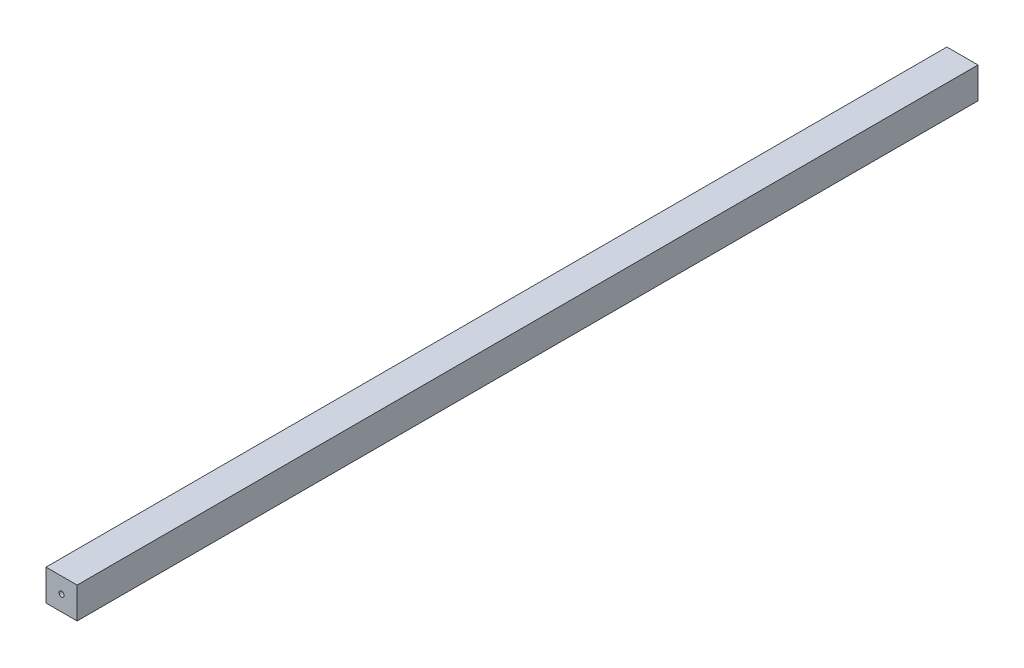
from build123d import *

# Parameters (mm, degrees)
SKETCH1_W           = 25.4
SKETCH1_H           = 25.4
BOSS_EXTRUDE1_DEPTH = 367.665
SKETCH2_R           = 2.0828
CUT_EXTRUDE1_DEPTH  = 812.292


with BuildPart() as part:
    # Sketch1 → Boss-Extrude1 (new, symmetric)
    with BuildSketch(Plane.XY):
        Rectangle(SKETCH1_W, SKETCH1_H)
    extrude(amount=BOSS_EXTRUDE1_DEPTH, both=True)

    # Sketch2 → Cut-Extrude1 (cut)
    with BuildSketch(Plane.XY.offset(367.665)):
        Circle(SKETCH2_R)
    extrude(amount=-CUT_EXTRUDE1_DEPTH, mode=Mode.SUBTRACT)


solid = part.part
